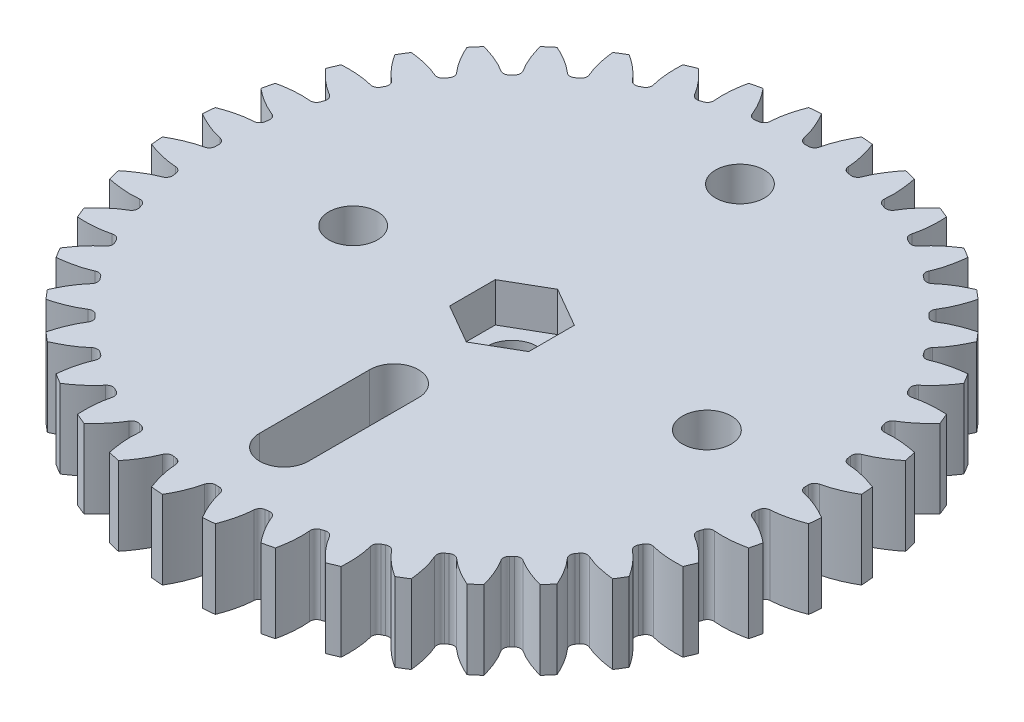
from build123d import *

# Parameters (mm, degrees)
SKETCH2_R                = 53.34
BOSS_EXTRUDE1_DEPTH      = 12.7
CUT_EXTRUDE1_DEPTH       = 12.7
FILLET2_R                = 1.016
CIRPATTERN1_COUNT        = 40
FILLET2_OF_CIRPATTERN1_R = 1.016
SKETCH4_R                = 4.09575
CUT_EXTRUDE2_DEPTH       = 77.359986682
CUT_EXTRUDE3_DEPTH       = 6.35
CUT_EXTRUDE4_DEPTH       = 77.359986682
CUT_EXTRUDE4_DEPTH_BACK  = 77.359986682
SKETCH6_R                = 3.937


with BuildPart() as part:
    # Sketch2 → Boss-Extrude1 (new body)
    with BuildSketch(Plane(origin=(0, 0, 0), x_dir=(1, 0, 0), z_dir=(0, 1, 0))):
        Circle(SKETCH2_R)
    extrude(amount=BOSS_EXTRUDE1_DEPTH)

    # Sketch3 → Cut-Extrude1 (cut)
    with BuildSketch(Plane(origin=(0, 0, 0), x_dir=(-1, 0, 0), z_dir=(0, -1, 0))):
        with BuildLine():
            Line((47.610863724, -1.16029328), (47.722215798, -1.163006969))
            add(Edge.make_bspline(
                [(47.722215798, -1.163006969), (47.730982789, -1.163313167), (47.755564012, -1.16445845), (47.802003051, -1.167754997), (47.87772523, -1.174741096), (47.974119041, -1.186004909), (48.098593622, -1.203276497), (48.245061479, -1.227112329), (48.405834144, -1.256963367), (48.580520514, -1.293386204), (48.754577285, -1.333212779), (48.927987969, -1.376189951), (49.100522746, -1.421931459), (49.30925176, -1.48080125), (49.559155717, -1.556203831), (49.850651678, -1.651349023), (50.180503564, -1.767531099), (50.515821541, -1.894787282), (50.845048793, -2.027276114), (51.176798745, -2.169495413), (51.497150175, -2.313020498), (51.828924093, -2.470658837), (52.134675109, -2.620519189), (52.476090794, -2.797888155), (52.751288045, -2.94379105), (53.034579939, -3.102405155), (53.172312998, -3.180768911), (53.242640535, -3.221308569)],
                knots=[0, 0, 0, 0, 0, 0.005376749, 0.015083688, 0.02853182, 0.04661014, 0.064854849, 0.092110526, 0.119476176, 0.146842496, 0.174208854, 0.201574956, 0.228941013, 0.256307345, 0.307035032, 0.361767352, 0.416499661, 0.471231937, 0.525964282, 0.580696616, 0.635428982, 0.690161387, 0.744893688, 0.799626082, 0.854358407, 0.909090914, 0.909090914, 0.909090914, 0.909090914, 0.909090914], degree=4))
            ThreePointArc((53.242640535, -3.221308569), (53.34, 0), (53.242640535, 3.221308569))
            add(Edge.make_bspline(
                [(53.242640535, 3.221308569), (53.172312998, 3.180768911), (53.034579939, 3.102405155), (52.751288045, 2.94379105), (52.476090794, 2.797888155), (52.134675109, 2.620519189), (51.828924093, 2.470658837), (51.497150175, 2.313020498), (51.176798745, 2.169495413), (50.845048793, 2.027276114), (50.515821541, 1.894787282), (50.180503564, 1.767531099), (49.850651678, 1.651349023), (49.559155717, 1.556203831), (49.30925176, 1.48080125), (49.100522746, 1.421931459), (48.927987969, 1.376189951), (48.754577285, 1.333212779), (48.580520514, 1.293386204), (48.405834144, 1.256963367), (48.245061479, 1.227112329), (48.098593622, 1.203276497), (47.974119041, 1.186004909), (47.87772523, 1.174741096), (47.80200305, 1.167754997), (47.755564012, 1.16445845), (47.730982789, 1.163313167), (47.722215798, 1.163006969)],
                knots=[0.484570751, 0.484570751, 0.484570751, 0.484570751, 0.484570751, 0.539303258, 0.594035583, 0.648767977, 0.703500278, 0.758232683, 0.81296505, 0.867697383, 0.922429728, 0.977162004, 1.031894313, 1.086626633, 1.13735432, 1.164720652, 1.19208671, 1.219452811, 1.246819169, 1.274185489, 1.30155114, 1.328806816, 1.347051526, 1.365129845, 1.378577977, 1.388284917, 1.393661665, 1.393661665, 1.393661665, 1.393661665, 1.393661665], degree=4))
            Line((47.722215798, 1.163006969), (47.610863724, 1.16029328))
            ThreePointArc((47.610863724, 1.16029328), (47.625, 0), (47.610863724, -1.16029328))
        make_face()
    cut_extrude1 = extrude(amount=-CUT_EXTRUDE1_DEPTH, mode=Mode.SUBTRACT)

    # Fillet2
    fillet2_edges = [part.edges().sort_by_distance(p)[0] for p in [
        (-47.610863724, 6.35, -1.16029328),
        (-47.610863724, 6.35, 1.16029328),
    ]]
    fillet(fillet2_edges, radius=FILLET2_R)

    # CirPattern1: Cut-Extrude1 ×40 about axis
    cirpattern1_axis = Axis((0, 12.7, 0), (0, 1, 0))
    for i in range(1, CIRPATTERN1_COUNT):
        add(cut_extrude1.rotate(cirpattern1_axis, i * 360 / CIRPATTERN1_COUNT), mode=Mode.SUBTRACT)

    # Fillet2 of CirPattern1
    fillet2_of_cirpattern1_edges = [part.edges().sort_by_distance(p)[0] for p in [
        (-47.206204844, 6.35, 6.301971852),
        (-46.843185127, 6.35, 8.593988141),
        (-45.639172533, 6.35, 13.609061523),
        (-44.922071849, 6.35, 15.816070492),
        (-42.948352326, 6.35, 20.581050932),
        (-41.894828074, 6.35, 22.648708697),
        (-39.200001148, 6.35, 27.046266564),
        (-37.835994591, 6.35, 28.923660528),
        (-34.486415844, 6.35, 32.845513351),
        (-32.845513351, 6.35, 34.486415844),
        (-28.923660528, 6.35, 37.835994591),
        (-27.046266564, 6.35, 39.200001148),
        (-22.648708697, 6.35, 41.894828074),
        (-20.581050932, 6.35, 42.948352326),
        (-15.816070492, 6.35, 44.922071849),
        (-13.609061523, 6.35, 45.639172533),
        (-8.593988141, 6.35, 46.843185127),
        (-6.301971852, 6.35, 47.206204844),
        (-1.16029328, 6.35, 47.610863724),
        (1.16029328, 6.35, 47.610863724),
        (6.301971852, 6.35, 47.206204844),
        (8.593988141, 6.35, 46.843185127),
        (13.609061523, 6.35, 45.639172533),
        (15.816070492, 6.35, 44.922071849),
        (20.581050932, 6.35, 42.948352326),
        (22.648708697, 6.35, 41.894828074),
        (27.046266564, 6.35, 39.200001148),
        (28.923660528, 6.35, 37.835994591),
        (32.845513351, 6.35, 34.486415844),
        (34.486415844, 6.35, 32.845513351),
        (37.835994591, 6.35, 28.923660528),
        (39.200001148, 6.35, 27.046266564),
        (41.894828074, 6.35, 22.648708697),
        (42.948352326, 6.35, 20.581050932),
        (44.922071849, 6.35, 15.816070492),
        (45.639172533, 6.35, 13.609061523),
        (46.843185127, 6.35, 8.593988141),
        (47.206204844, 6.35, 6.301971852),
        (47.610863724, 6.35, 1.16029328),
        (47.610863724, 6.35, -1.16029328),
        (47.206204844, 6.35, -6.301971852),
        (46.843185127, 6.35, -8.593988141),
        (45.639172533, 6.35, -13.609061523),
        (44.922071849, 6.35, -15.816070492),
        (42.948352326, 6.35, -20.581050932),
        (41.894828074, 6.35, -22.648708697),
        (39.200001148, 6.35, -27.046266564),
        (37.835994591, 6.35, -28.923660528),
        (34.486415844, 6.35, -32.845513351),
        (32.845513351, 6.35, -34.486415844),
        (28.923660528, 6.35, -37.835994591),
        (27.046266564, 6.35, -39.200001148),
        (22.648708697, 6.35, -41.894828074),
        (20.581050932, 6.35, -42.948352326),
        (15.816070492, 6.35, -44.922071849),
        (13.609061523, 6.35, -45.639172533),
        (8.593988141, 6.35, -46.843185127),
        (6.301971852, 6.35, -47.206204844),
        (1.16029328, 6.35, -47.610863724),
        (-1.16029328, 6.35, -47.610863724),
        (-6.301971852, 6.35, -47.206204844),
        (-8.593988141, 6.35, -46.843185127),
        (-13.609061523, 6.35, -45.639172533),
        (-15.816070492, 6.35, -44.922071849),
        (-20.581050932, 6.35, -42.948352326),
        (-22.648708697, 6.35, -41.894828074),
        (-27.046266564, 6.35, -39.200001148),
        (-28.923660528, 6.35, -37.835994591),
        (-32.845513351, 6.35, -34.486415844),
        (-34.486415844, 6.35, -32.845513351),
        (-37.835994591, 6.35, -28.923660528),
        (-39.200001148, 6.35, -27.046266564),
        (-41.894828074, 6.35, -22.648708697),
        (-42.948352326, 6.35, -20.581050932),
        (-44.922071849, 6.35, -15.816070492),
        (-45.639172533, 6.35, -13.609061523),
        (-46.843185127, 6.35, -8.593988141),
        (-47.206204844, 6.35, -6.301971852),
    ]]
    fillet(fillet2_of_cirpattern1_edges, radius=FILLET2_OF_CIRPATTERN1_R)

    # Sketch4 → Cut-Extrude2 (cut, through all)
    with BuildSketch(Plane(origin=(0, 12.7, 0), x_dir=(1, 0, 0), z_dir=(0, 1, 0))):
        Circle(SKETCH4_R)
    extrude(amount=-CUT_EXTRUDE2_DEPTH, mode=Mode.SUBTRACT)

    # Sketch5 → Cut-Extrude3 (cut)
    with BuildSketch(Plane(origin=(0, 12.7, 0), x_dir=(1, 0, 0), z_dir=(0, 1, 0))):
        Polygon((0, 7.376342509), (-6.3881, 3.688171255), (-6.3881, -3.688171255), (0, -7.376342509), (6.3881, -3.688171255), (6.3881, 3.688171255), align=None)
    extrude(amount=-CUT_EXTRUDE3_DEPTH, mode=Mode.SUBTRACT)

    # Sketch6 → Cut-Extrude4 (cut, two sides: drawn at the far end of the back side and taken through both)
    with BuildSketch(Plane(origin=(0, 12.7, 0), x_dir=(1, 0, 0), z_dir=(0, 1, 0)).offset(-CUT_EXTRUDE4_DEPTH_BACK)):
        with Locations((0, 36.83)):
            Circle(SKETCH6_R)
        with Locations((31.75, -0.262923867)):
            Circle(SKETCH6_R)
        with Locations((-25.4, -0.262923867)):
            Circle(SKETCH6_R)
        with BuildLine():
            Line((3.937, -19.05), (3.937, -36.83))
            ThreePointArc((3.937, -36.83), (0, -40.767), (-3.937, -36.83))
            Line((-3.937, -36.83), (-3.937, -19.05))
            ThreePointArc((-3.937, -19.05), (0, -15.113), (3.937, -19.05))
        make_face()
    extrude(amount=CUT_EXTRUDE4_DEPTH + CUT_EXTRUDE4_DEPTH_BACK, mode=Mode.SUBTRACT)


solid = part.part
